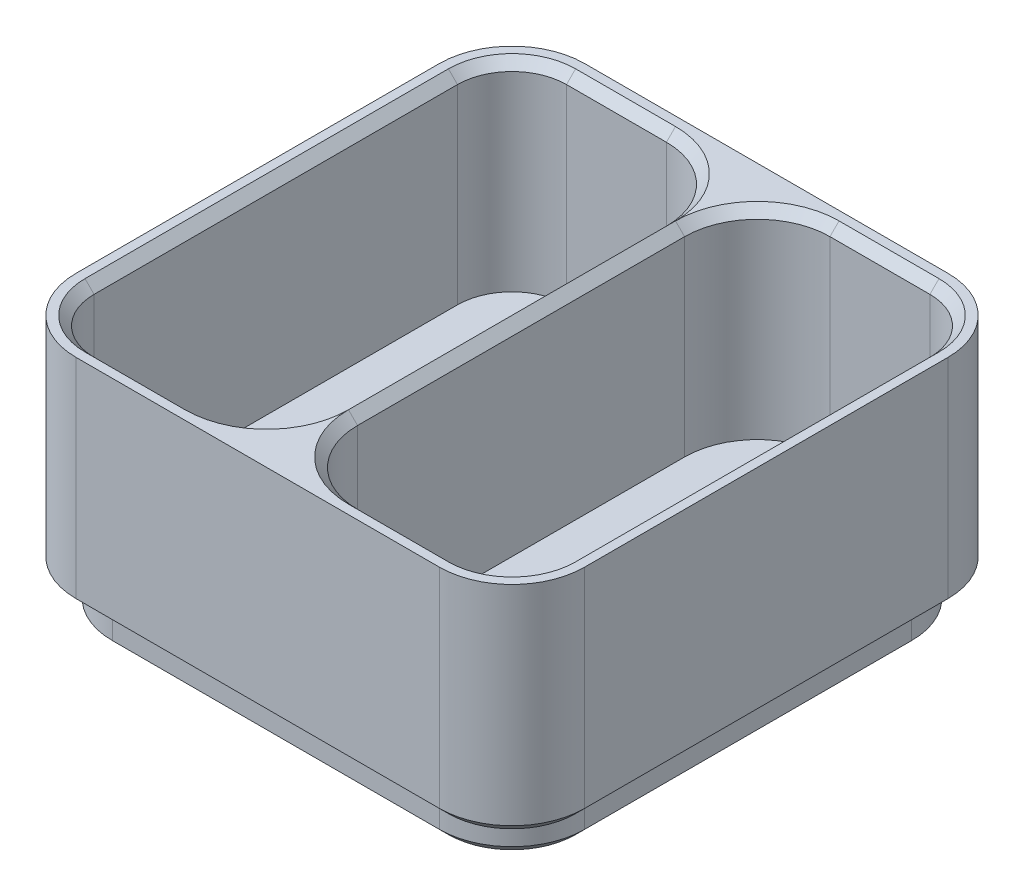
from build123d import *

# Parameters (mm, degrees)
BOSS_EXTRUDE4_DEPTH = 5
SKETCH6_W           = 70
SKETCH6_H           = 70
BOSS_EXTRUDE5_DEPTH = 30
SKETCH8_R           = 3
CUT_EXTRUDE1_DEPTH  = 2
FILLET1_R           = 10
CUT_EXTRUDE2_DEPTH  = 30
BOSS_EXTRUDE6_DEPTH = 2.5
SKETCH11_W          = 2.5
SKETCH11_H          = 65
BOSS_EXTRUDE7_DEPTH = 27.5
FILLET2_R           = 10
CHAMFER1_SIZE       = 1.25
CHAMFER2_SIZE       = 1.25


with BuildPart() as part:
    # Sketch5 → Boss-Extrude4 (new body)
    with BuildSketch(Plane(origin=(0, 0, 0), x_dir=(1, 0, 0), z_dir=(0, 1, 0))):
        with BuildLine():
            Line((-22.5, -32.5), (22.5, -32.5))
            ThreePointArc((22.5, -32.5), (29.571067812, -29.571067812), (32.5, -22.5))
            Line((32.5, -22.5), (32.5, 22.5))
            ThreePointArc((32.5, 22.5), (29.571067812, 29.571067812), (22.5, 32.5))
            Line((22.5, 32.5), (-22.5, 32.5))
            ThreePointArc((-22.5, 32.5), (-29.571067812, 29.571067812), (-32.5, 22.5))
            Line((-32.5, 22.5), (-32.5, -22.5))
            ThreePointArc((-32.5, -22.5), (-29.571067812, -29.571067812), (-22.5, -32.5))
        make_face()
    extrude(amount=BOSS_EXTRUDE4_DEPTH)

    # Sketch6 → Boss-Extrude5 (add)
    with BuildSketch(Plane(origin=(0, 5, 0), x_dir=(1, 0, 0), z_dir=(0, 1, 0))):
        Rectangle(SKETCH6_W, SKETCH6_H)
    extrude(amount=BOSS_EXTRUDE5_DEPTH)

    # Sketch8 → Cut-Extrude1 (cut)
    with BuildSketch(Plane.XZ):
        with Locations(Location((26.037533906, -26.035533906, 0), (0, 0, 270))):
            Circle(SKETCH8_R)
        with Locations(Location((26.036533906, 26.036533906, 0), (0, 0, 270))):
            Circle(SKETCH8_R)
        with BuildLine():
            ThreePointArc((-23.035533906, 26.035533906), (-24.887483609, 28.807172503), (-28.156854249, 28.156854249))
            Line((-28.156854249, 28.156854249), (-23.914213562, 23.914213562))
            ThreePointArc((-23.914213562, 23.914213562), (-23.263895308, 24.887483609), (-23.035533906, 26.035533906))
        make_face()
        with BuildLine():
            Line((-23.914213562, 23.914213562), (-28.156854249, 28.156854249))
            ThreePointArc((-28.156854249, 28.156854249), (-28.156854249, 23.914213562), (-23.914213562, 23.914213562))
        make_face()
        with Locations(Location((-26.034533906, -26.036533906, 0), (0, 0, 270))):
            Circle(SKETCH8_R)
    extrude(amount=-CUT_EXTRUDE1_DEPTH, mode=Mode.SUBTRACT)

    # Fillet1
    fillet1_edges = [part.edges().sort_by_distance(p)[0] for p in [
        (-35, 20, -35),
        (-35, 20, 35),
        (35, 20, 35),
        (35, 20, -35),
    ]]
    fillet(fillet1_edges, radius=FILLET1_R)

    # Sketch9 → Cut-Extrude2 (cut)
    with BuildSketch(Plane(origin=(0, 35, 0), x_dir=(1, 0, 0), z_dir=(0, 1, 0))):
        with BuildLine():
            Line((25, 32.5), (-25, 32.5))
            ThreePointArc((-25, 32.5), (-30.303300859, 30.303300859), (-32.5, 25))
            Line((-32.5, 25), (-32.5, -25))
            ThreePointArc((-32.5, -25), (-30.303300859, -30.303300859), (-25, -32.5))
            Line((-25, -32.5), (25, -32.5))
            ThreePointArc((25, -32.5), (30.303300859, -30.303300859), (32.5, -25))
            Line((32.5, -25), (32.5, 25))
            ThreePointArc((32.5, 25), (30.303300859, 30.303300859), (25, 32.5))
        make_face()
    extrude(amount=-CUT_EXTRUDE2_DEPTH, mode=Mode.SUBTRACT)


with BuildPart() as cut_extrude2_piece_1:
    # of the separate pieces the step leaves, piece 1, a body of its own (cut_extrude2_pieces)
    add(part.part.solids().sort_by_distance((-22.5, 0, 32.5))[0])



with BuildPart() as cut_extrude2_piece_2:
    # of the separate pieces the step leaves, piece 2, a body of its own (cut_extrude2_pieces)
    add(part.part.solids().sort_by_distance((25, 5, -35))[0])


with BuildPart() as cut_extrude2_piece_1_1:
    add(cut_extrude2_piece_1.part)

    add(cut_extrude2_piece_2.part)  # Boss-Extrude6 merges Cut-Extrude2 piece 2
    # Sketch10 → Boss-Extrude6 (add)
    with BuildSketch(Plane.XZ.offset(-5)):
        with BuildLine():
            Line((-35, 25), (-35, -25))
            ThreePointArc((-35, -25), (-32.071067812, -32.071067812), (-25, -35))
            Line((-25, -35), (25, -35))
            ThreePointArc((25, -35), (32.071067812, -32.071067812), (35, -25))
            Line((35, -25), (35, 25))
            ThreePointArc((35, 25), (32.071067812, 32.071067812), (25, 35))
            Line((25, 35), (-25, 35))
            ThreePointArc((-25, 35), (-32.071067812, 32.071067812), (-35, 25))
        make_face()
    extrude(amount=-BOSS_EXTRUDE6_DEPTH)

    # Sketch11 → Boss-Extrude7 (add)
    with BuildSketch(Plane(origin=(0, 35, 0), x_dir=(1, 0, 0), z_dir=(0, 1, 0))):
        Rectangle(SKETCH11_W, SKETCH11_H)
    extrude(amount=-BOSS_EXTRUDE7_DEPTH)

    # Fillet2
    fillet2_edges = [cut_extrude2_piece_1_1.edges().sort_by_distance(p)[0] for p in [
        (-1.25, 21.25, -32.5),
        (-1.25, 21.25, 32.5),
        (1.25, 21.25, 32.5),
        (1.25, 21.25, -32.5),
    ]]
    fillet(fillet2_edges, radius=FILLET2_R)

    # Chamfer1
    chamfer1_edges = [cut_extrude2_piece_1_1.edges().sort_by_distance(p)[0] for p in [
        (18.125, 35, -32.5),
        (-30.303300859, 35, -30.303300859),
        (-32.5, 35, 0),
        (-30.303300859, 35, 30.303300859),
        (-18.125, 35, 32.5),
        (30.303300859, 35, 30.303300859),
        (32.5, 35, 0),
        (1.25, 35, 0),
        (18.125, 35, 32.5),
        (-1.25, 35, 0),
        (-18.125, 35, -32.5),
        (4.178932188, 35, -29.571067812),
        (4.178932188, 35, 29.571067812),
        (-4.178932188, 35, 29.571067812),
        (-4.178932188, 35, -29.571067812),
        (30.303300859, 35, -30.303300859),
    ]]
    chamfer(chamfer1_edges, length=CHAMFER1_SIZE - 0.0001)  # a hair under: the kernel refuses the full size

    # Chamfer2
    chamfer2_edges = [cut_extrude2_piece_1_1.edges().sort_by_distance(p)[0] for p in [
        (-29.571067812, 0, 29.571067812),
        (0, 0, 32.5),
        (29.571067812, 0, 29.571067812),
        (32.5, 0, 0),
        (29.571067812, 0, -29.571067812),
        (0, 0, -32.5),
        (-29.571067812, 0, -29.571067812),
        (-32.5, 0, 0),
        (-35, 5, 0),
        (0, 5, -35),
        (35, 5, 0),
        (0, 5, 35),
        (32.071067812, 5, -32.071067812),
        (32.071067812, 5, 32.071067812),
        (-32.071067812, 5, 32.071067812),
        (-32.071067812, 5, -32.071067812),
    ]]
    chamfer(chamfer2_edges, length=CHAMFER2_SIZE)


solid = cut_extrude2_piece_1_1.part
